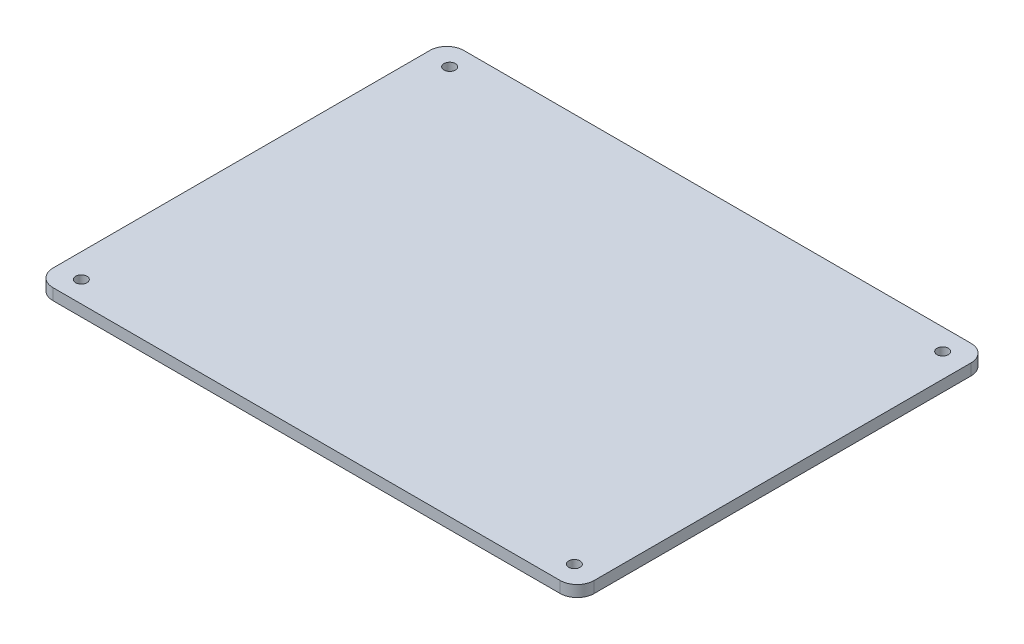
from build123d import *

# Parameters (mm, degrees)
EXTRUDE_1_DEPTH          = 2
CUT_EXTRUDE_1_DEPTH      = 3
CUT_EXTRUDE_1_DEPTH_BACK = 13
SKETCH_3_R               = 1
SKETCH_4_W               = 38
SKETCH_4_H               = 14
EXTRUDE_3_DEPTH          = 3
SKETCH_5_W               = 2
SKETCH_5_H               = 14
CUT_EXTRUDE_3_DEPTH      = 1.5


with BuildPart() as part:
    # Эскиз1 → Бобышка-Вытянуть1 (new body)
    with BuildSketch(Plane(origin=(0, 0, 0), x_dir=(1, 0, 0), z_dir=(0, 1, 0))):
        with BuildLine():
            Line((-47.75, -33.25), (-47.75, 33.25))
            ThreePointArc((-47.75, 33.25), (-46.871320344, 35.371320344), (-44.75, 36.25))
            Line((-44.75, 36.25), (44.75, 36.25))
            ThreePointArc((44.75, 36.25), (46.871320344, 35.371320344), (47.75, 33.25))
            Line((47.75, 33.25), (47.75, -33.25))
            ThreePointArc((47.75, -33.25), (46.871320344, -35.371320344), (44.75, -36.25))
            Line((44.75, -36.25), (-44.75, -36.25))
            ThreePointArc((-44.75, -36.25), (-46.871320344, -35.371320344), (-47.75, -33.25))
        make_face()
    extrude(amount=EXTRUDE_1_DEPTH)

    # Эскиз3 → Вырез-Вытянуть1 (cut, two sides: drawn at the far end of the back side and taken through both)
    with BuildSketch(Plane(origin=(0, 5, 0), x_dir=(1, 0, 0), z_dir=(0, 1, 0)).offset(-CUT_EXTRUDE_1_DEPTH_BACK)):
        with Locations((-43.5, 32.5)):
            Circle(SKETCH_3_R)
        with Locations((-43.5, -32.5)):
            Circle(SKETCH_3_R)
        with Locations((43.5, -32.5)):
            Circle(SKETCH_3_R)
        with Locations((43.5, 32.5)):
            Circle(SKETCH_3_R)
    extrude(amount=CUT_EXTRUDE_1_DEPTH + CUT_EXTRUDE_1_DEPTH_BACK, mode=Mode.SUBTRACT)

    # Эскиз4 → Бобышка-Вытянуть3 (add)
    with BuildSketch(Plane.XZ):
        Rectangle(SKETCH_4_W, SKETCH_4_H)
    extrude(amount=EXTRUDE_3_DEPTH)

    # Эскиз5 → Вырез-Вытянуть3 (cut)
    with BuildSketch(Plane.XZ):
        with Locations((18, 0)):
            Rectangle(SKETCH_5_W, SKETCH_5_H)
        with Locations((-18, 0)):
            Rectangle(SKETCH_5_W, SKETCH_5_H)
    extrude(amount=CUT_EXTRUDE_3_DEPTH, mode=Mode.SUBTRACT)


solid = part.part
